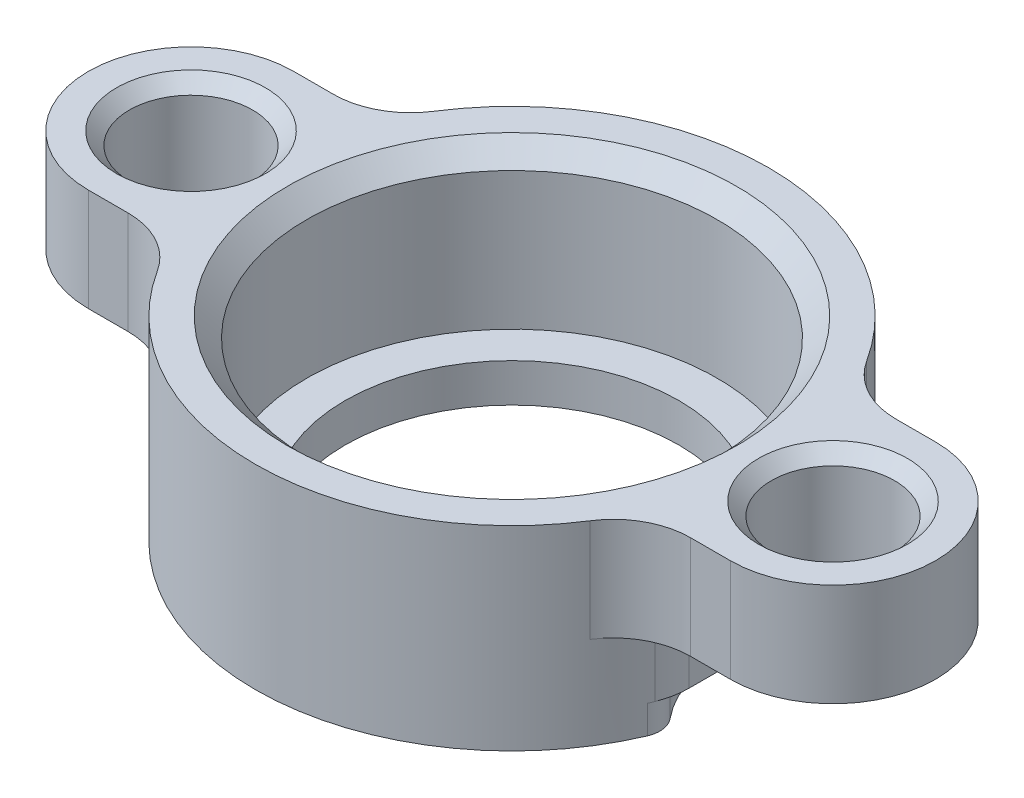
from build123d import *

# Parameters (mm, degrees)
BOSS_EXTRU_1_DEPTH             = 4
ENL_V_START                    = -4
ENL_V_MAT_EXTRU_3_DEPTH        = 3.6
CONG_2_R                       = 3
CONG_3_R                       = 3
CONG_2_OF_SYM_TRIE1_R          = 3
CONG_3_OF_SYM_TRIE1_R          = 3
F_4_8_4_8_DIAMETER_HOLE2_D     = 4.8
F_4_8_4_8_DIAMETER_HOLE2_DEPTH = 6.4
F_4_8_4_8_DIAMETER_HOLE2_TIP   = 1.442065486
CHANFREIN1_SIZE                = 0.5
ESQUISSE9_R                    = 4.5
ENL_V_MAT_EXTRU_4_DEPTH        = 1.1
CONG_4_R                       = 1
CHANFREIN2_SIZE                = 0.75


with BuildPart() as part:
    # Esquisse1 → Révolution1 (revolve)
    with BuildSketch(Plane.XY, mode=Mode.PRIVATE) as r_volution1_sk:
        Polygon((-6.5, -4), (-6.5, -5.5), (-10, -5.5), (-10, 2.1), (-8, 2.1), (-8, -4), align=None)
    revolve(r_volution1_sk.sketch.rotate(Axis((0, 6.608552154, 0), (0, -1, 0)), 270), axis=Axis((0, 6.608552154, 0), (0, -1, 0)))

    # Esquisse2 → Boss.-Extru.1 (add)
    with BuildSketch(Plane(origin=(0, 2.1, 0), x_dir=(1, 0, 0), z_dir=(0, 1, 0))):
        with BuildLine():
            Line((-12.5, -4), (-9.16515139, -4))
            ThreePointArc((-9.16515139, -4), (-10, 0), (-9.16515139, 4))
            Line((-9.16515139, 4), (-12.5, 4))
            ThreePointArc((-12.5, 4), (-16.5, 0), (-12.5, -4))
        make_face()
    boss_extru_1 = extrude(amount=-BOSS_EXTRU_1_DEPTH)

    # Esquisse2<6> → Enlèv. mat.-Extru.3 (cut)
    with BuildSketch(Plane(origin=(0, 2.1, 0), x_dir=(1, 0, 0), z_dir=(0, 1, 0)).offset(ENL_V_START)):
        with BuildLine():
            ThreePointArc((-9.5, 3.122498999), (-10, 0), (-9.5, -3.122498999))
            Line((-9.5, -3.122498999), (-9.5, 3.122498999))
        make_face()
    enl_v_mat_extru_3 = extrude(amount=-ENL_V_MAT_EXTRU_3_DEPTH, mode=Mode.SUBTRACT)

    # Congé2
    cong_2_edges = [part.edges().sort_by_distance(p)[0] for p in [
        (-9.5, -3.7, 3.122498999),
        (-9.5, -3.7, -3.122498999),
    ]]
    fillet(cong_2_edges, radius=CONG_2_R)

    # Congé3
    cong_3_edges = [part.edges().sort_by_distance(p)[0] for p in [
        (-9.16515139, 0.1, -4),
        (-9.16515139, 0.1, 4),
    ]]
    fillet(cong_3_edges, radius=CONG_3_R)

    # Symétrie1: Boss.-Extru.1, Enlèv. mat.-Extru.3 across plane
    add(boss_extru_1.mirror(Plane(origin=(0, 0, 0), x_dir=(0, 0, 1), z_dir=(1, 0, 0))))
    add(enl_v_mat_extru_3.mirror(Plane(origin=(0, 0, 0), x_dir=(0, 0, 1), z_dir=(1, 0, 0))), mode=Mode.SUBTRACT)

    # Congé2 of Symétrie1
    cong_2_of_sym_trie1_edges = [part.edges().sort_by_distance(p)[0] for p in [
        (9.5, -3.7, 3.122498999),
        (9.5, -3.7, -3.122498999),
    ]]
    fillet(cong_2_of_sym_trie1_edges, radius=CONG_2_OF_SYM_TRIE1_R)

    # Congé3 of Symétrie1
    cong_3_of_sym_trie1_edges = [part.edges().sort_by_distance(p)[0] for p in [
        (9.16515139, 0.1, -4),
        (9.16515139, 0.1, 4),
    ]]
    fillet(cong_3_of_sym_trie1_edges, radius=CONG_3_OF_SYM_TRIE1_R)

    # Ø4.8 (4.8) Diameter Hole2
    with Locations(Plane(origin=(0, 2.1, 0), x_dir=(1, 0, 0), z_dir=(0, 1, 0))):
        with Locations((-12.5, 0), (12.5, 0)):
            Hole(F_4_8_4_8_DIAMETER_HOLE2_D / 2, depth=F_4_8_4_8_DIAMETER_HOLE2_DEPTH)
            with Locations((0, 0, -(F_4_8_4_8_DIAMETER_HOLE2_DEPTH + F_4_8_4_8_DIAMETER_HOLE2_TIP / 2))):  # 118° drill point
                Cone(0, F_4_8_4_8_DIAMETER_HOLE2_D / 2, F_4_8_4_8_DIAMETER_HOLE2_TIP, mode=Mode.SUBTRACT)

    # Chanfrein1
    chanfrein1_edges = [part.edges().sort_by_distance(p)[0] for p in [
        (14.9, 2.1, 0),
        (-10.1, 2.1, 0),
    ]]
    chamfer(chanfrein1_edges, length=CHANFREIN1_SIZE)

    # Esquisse9 → Enlèv. mat.-Extru.4 (cut)
    with BuildSketch(Plane.XZ.offset(5.5)):
        with Locations((-12.5, 0)):
            Circle(ESQUISSE9_R)
        with Locations((12.5, 0)):
            Circle(ESQUISSE9_R)
    extrude(amount=-ENL_V_MAT_EXTRU_4_DEPTH, mode=Mode.SUBTRACT)

    # Congé4
    # the kernel refuses this fillet: 1 mm, written as the material it takes off along each edge
    with BuildSketch(Plane(origin=(9.421052632, -4.4, 3.281780477), x_dir=(-0.686560042836171, 0, -0.7270731102033653), z_dir=(0, -1, 0))) as cong_4_piece_1:
        with BuildLine():
            CenterArc((0.604915781, -0.998168708), CONG_4_R, 93.468029374, 62.964308211)
            Line((-0.311672758, -0.598336932), (-0.403331612, -0.558353754))
            ThreePointArc((-0.403331612, -0.558353754), (-0.310284429, -0.351422835), (-0.083419367, 0.05514716))
            Line((-0.083419367, 0.05514716), (0.006049158, 0.099816871))
            ThreePointArc((0.006049158, 0.099816871), (0.272212102, 0.091759185), (0.538375045, 0.099816871))
            Line((0.538375045, 0.099816871), (0.544424203, 0))
        make_face()
    extrude(amount=2.786614567, mode=Mode.SUBTRACT)
    with BuildSketch(Plane(origin=(9.421052632, -4.4, -3.281780477), x_dir=(-0.6865600428361709, 0, 0.7270731102033654), z_dir=(0, -1, 0)), Plane(origin=(-9.421052632, -4.4, 3.281780477), x_dir=(0.6865600428361707, 0, -0.7270731102033658), z_dir=(0, -1, 0))) as cong_4_piece_2:
        with BuildLine():
            CenterArc((0.604915781, 0.998168708), CONG_4_R, 203.567662416, 62.964308211)
            Line((-0.311672758, 0.598336932), (-0.403331612, 0.558353754))
            ThreePointArc((-0.403331612, 0.558353754), (-0.310284429, 0.351422835), (-0.083419367, -0.05514716))
            Line((-0.083419367, -0.05514716), (0.006049158, -0.099816871))
            ThreePointArc((0.006049158, -0.099816871), (0.272212102, -0.091759185), (0.538375045, -0.099816871))
            Line((0.538375045, -0.099816871), (0.544424203, 0))
        make_face()
    extrude(amount=2.786614567, mode=Mode.SUBTRACT)
    with BuildSketch(Plane(origin=(-9.421052632, -4.4, -3.281780477), x_dir=(0.3276573021844398, 0, -0.9447966407249841), z_dir=(0, -1, 0))) as cong_4_piece_3:
        with BuildLine():
            CenterArc((0.605807396, 0.997627822), CONG_4_R, 210.982965052, 62.964308211)
            Line((-0.251512996, 0.482844619), (-0.337245035, 0.431366299))
            ThreePointArc((-0.337245035, 0.431366299), (-0.207136841, 0.199031418), (-0.091321217, -0.04074844))
            Line((-0.091321217, -0.04074844), (-0.010371424, -0.099460714))
            ThreePointArc((-0.010371424, -0.099460714), (0.455018696, -0.112838034), (0.68152967, -0.099762782))
            Line((0.68152967, -0.099762782), (0.674645827, 0))
        make_face()
    extrude(amount=2.786614567, mode=Mode.SUBTRACT)

    # Chanfrein2
    chanfrein2_edges = [part.edges().sort_by_distance(p)[0] for p in [
        (0, 2.1, -8),
    ]]
    chamfer(chanfrein2_edges, length=CHANFREIN2_SIZE)


solid = part.part
